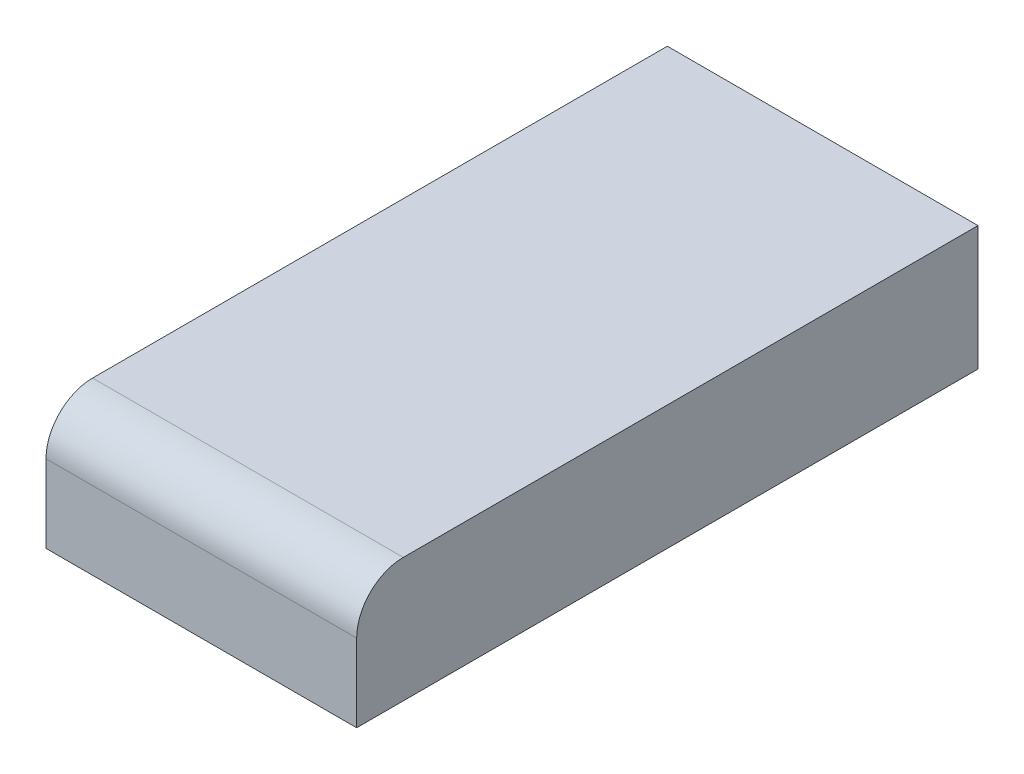
from build123d import *

# Parameters (mm, degrees)
SKETCH2_W           = 20
SKETCH2_H           = 40
BOSS_EXTRUDE2_DEPTH = 8
FILLET2_R           = 3


with BuildPart() as part:
    # Sketch2 → Boss-Extrude2 (new body)
    with BuildSketch(Plane(origin=(0, 33.757283518, 0), x_dir=(1, 0, 0), z_dir=(0, 1, 0))):
        with Locations((-90, 30.5)):
            Rectangle(SKETCH2_W, SKETCH2_H)
    extrude(amount=BOSS_EXTRUDE2_DEPTH)

    # Fillet2
    fillet2_edges = [part.edges().sort_by_distance(p)[0] for p in [
        (-90, 41.757283518, -10.5),
    ]]
    fillet(fillet2_edges, radius=FILLET2_R)


solid = part.part
